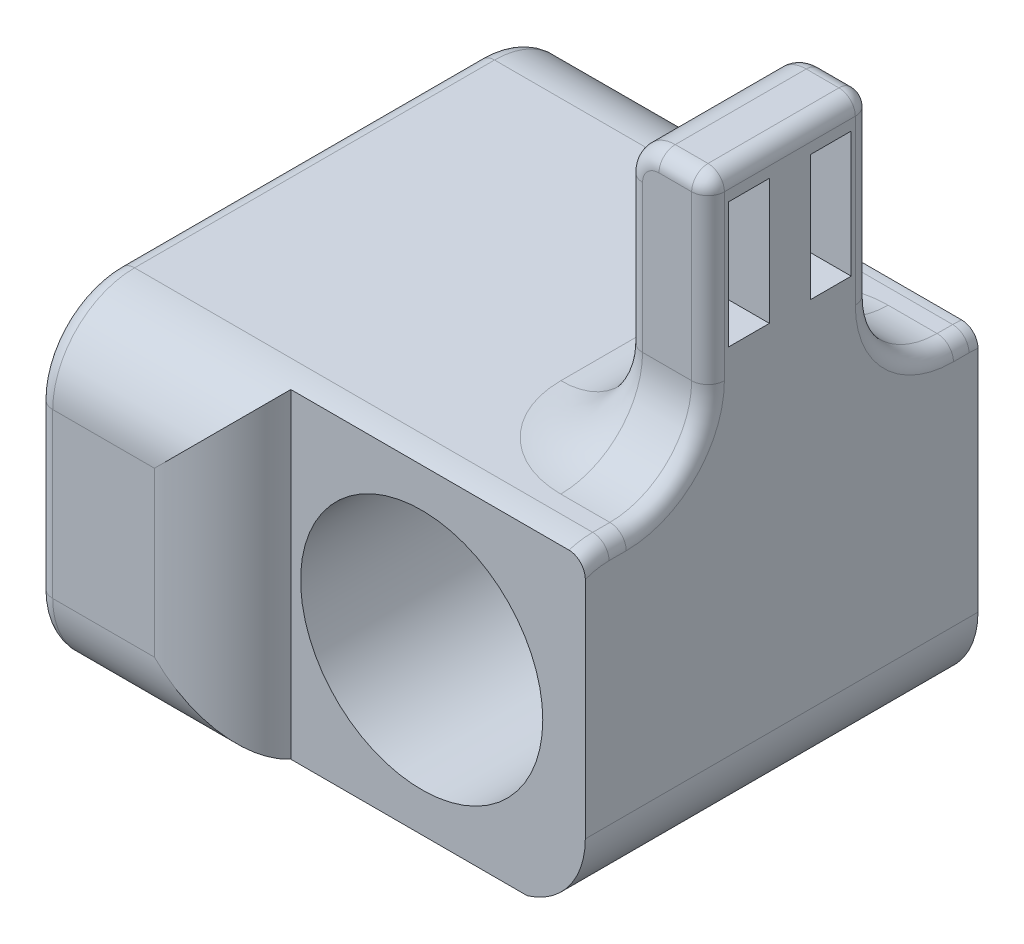
from build123d import *

# Parameters (mm, degrees)
ESQUISSE1_W                  = 20
ESQUISSE1_H                  = 20
BOSS_EXTRU_1_DEPTH           = 24
BOSS_EXTRU_2_DEPTH           = 10
BOSS_EXTRU_2_DEPTH_BACK      = 2
ESQUISSE2_W                  = 32
ESQUISSE2_H                  = 20.000000000000448
CONG_1_R                     = 5
ENL_V_MAT_EXTRU_1_DEPTH      = 37.18550592888275
ENL_V_MAT_EXTRU_1_DEPTH_BACK = 37.18550592888275
ESQUISSE3_R                  = 7.150000000000047
CONG_4_START                 = -21
CONG_4_DEPTH                 = 31
CONG_5_R                     = 1
CONG_7_R                     = 0.25
EMPREINTE1_START             = -20
EMPREINTE1_OUTLINE_R         = 4
EMPREINTE1_DEPTH             = 8.81
ESQUISSE11_R                 = 4.150000000000001
ENL_V_MAT_EXTRU_6_DEPTH      = 8.81
CONG_20_R                    = 0.25
CONG_15_R                    = 5
ESQUISSE7_R                  = 7.4
ENL_V_MAT_EXTRU_4_DEPTH      = 37.18550609247691
BOSS_EXTRUDE1_DEPTH          = 16
CUT_EXTRUDE1_DEPTH           = 16
FILLET1_R                    = 5
FILLET2_R                    = 2
FILLET3_R                    = 1
FILLET4_R                    = 1
FILLET5_START                = 6
FILLET5_DEPTH                = 4
FILLET5_2_ANGLE              = 90
FILLET6_START                = 6
FILLET6_DEPTH                = 4
FILLET6_2_ANGLE              = 90
FILLET8_R                    = 1


with BuildPart() as part:
    # Esquisse1 → Boss.-Extru.1 (new body)
    with BuildSketch(Plane.XY):
        Rectangle(ESQUISSE1_W, ESQUISSE1_H)
    extrude(amount=BOSS_EXTRU_1_DEPTH)

    # Esquisse2 → Boss.-Extru.2 (add, two sides: drawn at the far end of the back side and taken through both)
    with BuildSketch(Plane.ZY.offset(9.999999999999998).offset(-BOSS_EXTRU_2_DEPTH_BACK)):
        with Locations((11.550204933455245, 3.980016e-11)):
            Rectangle(ESQUISSE2_W, ESQUISSE2_H)
    extrude(amount=BOSS_EXTRU_2_DEPTH + BOSS_EXTRU_2_DEPTH_BACK)

    # Congé1
    # the kernel refuses this fillet: 5 mm, written as the material it takes off along each edge
    with BuildSketch(Plane(origin=(-7.999999999999998, 22.424088128349858, -4.449795066544754), x_dir=(-1, 0, 0), z_dir=(0, -1, 0))) as cong_1_piece_1:
        with BuildLine():
            CenterArc((4.969635251323934, -5), CONG_1_R, 90, 83.68232172298448)
            Line((0, -4.449795066544754), (-0.0993927050264789, -4.438790967875649))
            ThreePointArc((-0.0993927050264789, -4.438790967875649), (-0.09999999999999964, -2.2248975332723777), (-0.09999999999999964, 0))
            Line((-0.09999999999999964, 0), (0, 0.09999999999999964))
            Line((0, 0.09999999999999964), (4.969635251323934, 0.09999999999999964))
            Line((4.969635251323934, 0.09999999999999964), (4.969635251323934, 0))
        make_face()
    extrude(amount=44.848176256620114, mode=Mode.SUBTRACT)
    with BuildSketch(Plane(origin=(-7.999999999999998, -21.962988303740985, 27.550204933455245), x_dir=(2.5e-16, 0, -1), z_dir=(0, 1, 0))) as cong_1_piece_2:
        with BuildLine():
            CenterArc((4.999999999999999, 4.785195321512226), CONG_1_R, 180, 73.1444977745706)
            Line((-1.2e-15, 4.785195321512225), (-0.10000000000000261, 4.785195321512225))
            Line((-0.10000000000000261, 4.785195321512225), (-0.10000000000000142, -3e-17))
            Line((-0.10000000000000142, -3e-17), (3e-17, -0.09999999999999964))
            ThreePointArc((3e-17, -0.09999999999999964), (1.7751024667276205, -0.0999999999999992), (3.52120903212435, -0.09570390643024408))
            Line((3.52120903212435, -0.09570390643024408), (3.5502049334552446, 0))
        make_face()
    extrude(amount=43.92597660756157, mode=Mode.SUBTRACT)

    # Esquisse3 → Enlèv. mat.-Extru.1 (cut, two sides: drawn at the far end of the back side and taken through both)
    with BuildSketch(Plane.XY.offset(24).offset(-ENL_V_MAT_EXTRU_1_DEPTH_BACK)):
        with Locations(Location((0, 0, 0), (0, 0, 180))):
            Circle(ESQUISSE3_R)
    extrude(amount=ENL_V_MAT_EXTRU_1_DEPTH + ENL_V_MAT_EXTRU_1_DEPTH_BACK, mode=Mode.SUBTRACT)

    # Congé4: read off the stored shape, not the designer's step
    # Congé4 outline → Congé4 (cut)
    with BuildSketch(Plane.YZ.offset(CONG_4_START)):
        with BuildLine():
            ThreePointArc((-5, -4.449795067), (-8.535533905, -2.985328972), (-10, 0.550204933))
            Line((-10, 0.550204933), (-10, -4.449795067))
            Line((-10, -4.449795067), (-5, -4.449795067))
        make_face()
        with BuildLine():
            Line((-10, 27.550204933), (-10, 22.550204933))
            ThreePointArc((-10, 22.550204933), (-8.535533906, 26.085738839), (-5, 27.550204933))
            Line((-5, 27.550204933), (-10, 27.550204933))
        make_face()
        with BuildLine():
            ThreePointArc((10, 0.550204933), (8.535533905, -2.985328972), (5, -4.449795067))
            Line((5, -4.449795067), (10, -4.449795067))
            Line((10, -4.449795067), (10, 0.550204933))
        make_face()
        with BuildLine():
            Line((10, 27.550204933), (5, 27.550204933))
            ThreePointArc((5, 27.550204933), (8.535533906, 26.085738839), (10, 22.550204933))
            Line((10, 22.550204933), (10, 27.550204933))
        make_face()
    extrude(amount=CONG_4_DEPTH, mode=Mode.SUBTRACT)

    # Congé5
    cong_5_edges = [part.edges().sort_by_distance(p)[0] for p in [
        (-20, 0, -4.449795066544754),
        (-20, 0, 27.550204933455245),
        (-20, 10.000000000040023, 11.550204933),
        (-20, -9.999999999960423, 11.550204933),
        (-20, 8.535533906, 26.085738839),
        (-20, -8.535533906000001, 26.085738839),
        (-20, 8.535533905, -2.985328971999999),
        (-20, -8.535533905, -2.985328972),
    ]]
    fillet(cong_5_edges, radius=CONG_5_R)

    # Congé7
    cong_7_edges = [part.edges().sort_by_distance(p)[0] for p in [
        (7.150000000000047, -1.75e-15, 24),
        (7.150000000000047, -1.75e-15, 0),
    ]]
    fillet(cong_7_edges, radius=CONG_7_R)

    # Empreinte1: read off the stored shape, not the designer's step
    # Empreinte1 outline → Empreinte1 (cut)
    with BuildSketch(Plane.YZ.offset(EMPREINTE1_START)):
        with Locations((0, 2.285680752)):
            Circle(EMPREINTE1_OUTLINE_R)
        with Locations((0, 21.714319248)):
            Circle(EMPREINTE1_OUTLINE_R)
    extrude(amount=EMPREINTE1_DEPTH, mode=Mode.SUBTRACT)

    # Esquisse11 → Enlèv. mat.-Extru.6 (cut)
    with BuildSketch(Plane.ZY.offset(19.999999999999996)):
        with Locations((2.285680751772461, -6.103752e-11)):
            Circle(ESQUISSE11_R)
        with Locations((21.714319248000876, -5.865054e-11)):
            Circle(ESQUISSE11_R)
    extrude(amount=-ENL_V_MAT_EXTRU_6_DEPTH, mode=Mode.SUBTRACT)

    # Congé20
    cong_20_edges = [part.edges().sort_by_distance(p)[0] for p in [
        (-19.999999999999996, -6.103701e-11, -1.8643192482275404),
        (-19.999999999999996, -5.865003e-11, 17.564319248000874),
    ]]
    fillet(cong_20_edges, radius=CONG_20_R)

    # Congé15
    # the kernel refuses this fillet: 5 mm, written as the material it takes off along each edge
    with BuildSketch(Plane(origin=(10.000000000000002, -9.999999999999998, -11.949795067), x_dir=(-1, 0, 0), z_dir=(0, 0, 1))) as cong_15_piece_1:
        with BuildLine():
            CenterArc((CONG_15_R, -CONG_15_R), CONG_15_R, 90, 90)
            Line((0, -CONG_15_R), (0, 0))
            Line((0, 0), (CONG_15_R, 0))
        make_face()
    extrude(amount=47.00000000000001, mode=Mode.SUBTRACT)

    # Esquisse7 → Enlèv. mat.-Extru.4 (cut, through all)
    with BuildSketch(Plane.XY.offset(24)):
        Circle(ESQUISSE7_R)
    extrude(amount=-ENL_V_MAT_EXTRU_4_DEPTH, mode=Mode.SUBTRACT)

    # Sketch1 → Boss-Extrude1 (add)
    with BuildSketch(Plane(origin=(0, 10.000000000000002, 0), x_dir=(1, 0, 0), z_dir=(0, 1, 0))):
        Polygon((10.000000000000002, -6.5), (5.000000000000002, -6.5), (4.999999999999997, -16.5), (10.000000000000005, -16.5), align=None)
    extrude(amount=BOSS_EXTRUDE1_DEPTH)

    # Sketch2 → Cut-Extrude1 (cut)
    with BuildSketch(Plane.ZY.offset(-5.000000000000004)):
        Polygon((7.7499999999999964, 24.34), (10.249999999999995, 24.34), (10.249999999999995, 16.660000000000007), (7.749999999999998, 16.66), align=None)
        Polygon((12.749999999999998, 24.340000000000003), (15.249999999999998, 24.34), (15.25, 16.660000000000014), (12.749999999999998, 16.660000000000014), align=None)
    extrude(amount=-CUT_EXTRUDE1_DEPTH, mode=Mode.SUBTRACT)

    # Fillet1
    fillet1_edges = [part.edges().sort_by_distance(p)[0] for p in [
        (5, 10.000000000000002, 11.5),
    ]]
    fillet(fillet1_edges, radius=FILLET1_R)

    # Fillet2
    # the kernel refuses this fillet: 2 mm, written as the material it takes off along each edge
    with BuildSketch(Plane(origin=(5.0000000000000036, 26, 1.5), x_dir=(-4.4e-16, -1, 0), z_dir=(-4.4e-16, 0, 1))) as fillet2_piece_1:
        with BuildLine():
            CenterArc((FILLET2_R, FILLET2_R), FILLET2_R, 180, 90)
            Line((-8.9e-16, FILLET2_R), (0, 0))
            Line((0, 0), (FILLET2_R, 0))
        make_face()
    extrude(amount=20, mode=Mode.SUBTRACT)

    # Fillet3
    fillet3_edges = [part.edges().sort_by_distance(p)[0] for p in [
        (8.5, 26, 6.5),
        (3.535533905932739, 11.464466094107284, 6.500000000000002),
        (5.000000000000002, 19.50000000002001, 6.5),
        (5.585786437626905, 25.414213562373096, 6.5),
    ]]
    fillet(fillet3_edges, radius=FILLET3_R)

    # Fillet4
    fillet4_edges = [part.edges().sort_by_distance(p)[0] for p in [
        (3.5355339059327346, 11.464466094107284, 16.5),
        (8.500000000000004, 26, 16.5),
        (4.999999999999997, 19.50000000002001, 16.5),
        (5.585786437626905, 25.414213562373096, 16.5),
    ]]
    fillet(fillet4_edges, radius=FILLET4_R)

    # Fillet5: read off the stored shape, not the designer's step
    # Fillet5 outline → Fillet5 (add)
    with BuildSketch(Plane.YZ.offset(FILLET5_START)):
        with BuildLine():
            ThreePointArc((10, 1.5), (11.464466094, 5.035533906), (15, 6.5))
            Line((15, 6.5), (10, 6.5))
            Line((10, 6.5), (10, 1.5))
        make_face()
    extrude(amount=FILLET5_DEPTH)

    # Fillet5 2 outline → Fillet5 2 (revolve)
    with BuildSketch(Plane(origin=(6, 0, 7.5), x_dir=(-3.8e-16, 0, -1), z_dir=(1, 0, -3.8e-16))):
        with BuildLine():
            Line((1, 10), (6, 10))
            ThreePointArc((6, 10), (2.464466094, 11.464466094), (1, 15))
            Line((1, 15), (1, 10))
        make_face()
    revolve(axis=Axis((6, 0, 7.5), (0, 1, 0)), revolution_arc=FILLET5_2_ANGLE)

    # Fillet6: read off the stored shape, not the designer's step
    # Fillet6 outline → Fillet6 (add)
    with BuildSketch(Plane.YZ.offset(FILLET6_START)):
        with BuildLine():
            Line((10, 16.5), (15, 16.5))
            ThreePointArc((15, 16.5), (11.464466094, 17.964466094), (10, 21.5))
            Line((10, 21.5), (10, 16.5))
        make_face()
    extrude(amount=FILLET6_DEPTH)

    # Fillet6 2 outline → Fillet6 2 (revolve)
    with BuildSketch(Plane(origin=(6, 0, 15.5), x_dir=(-1, 0, -3.2e-16), z_dir=(3.2e-16, 0, -1))):
        with BuildLine():
            Line((1, 10), (6, 10))
            ThreePointArc((6, 10), (2.464466094, 11.464466094), (1, 15))
            Line((1, 15), (1, 10))
        make_face()
    revolve(axis=Axis((6, 0, 15.5), (0, 1, 0)), revolution_arc=FILLET6_2_ANGLE)

    # Fillet8
    fillet8_edges = [part.edges().sort_by_distance(p)[0] for p in [
        (10.000000000000002, 20, 6.5),
        (10.000000000000002, 25.707106781186546, 6.792893218813452),
        (10.000000000000004, 26, 11.5),
        (10.000000000000005, 20, 16.5),
        (10.000000000000002, 25.707106781186546, 16.207106781186546),
        (10.000000000000002, 10.000000000000002, 1.0251024665),
        (10, 11.464466094, 5.0355339059999995),
        (10, 11.464466094, 17.964466094),
        (10.000000000000002, 10.000000000000002, 22.0251024665),
        (10, 9.946007309310238, 23.28301575208052),
        (10, 9.99240304129454, 0.2746838420349517),
    ]]
    fillet(fillet8_edges, radius=FILLET8_R)


solid = part.part
